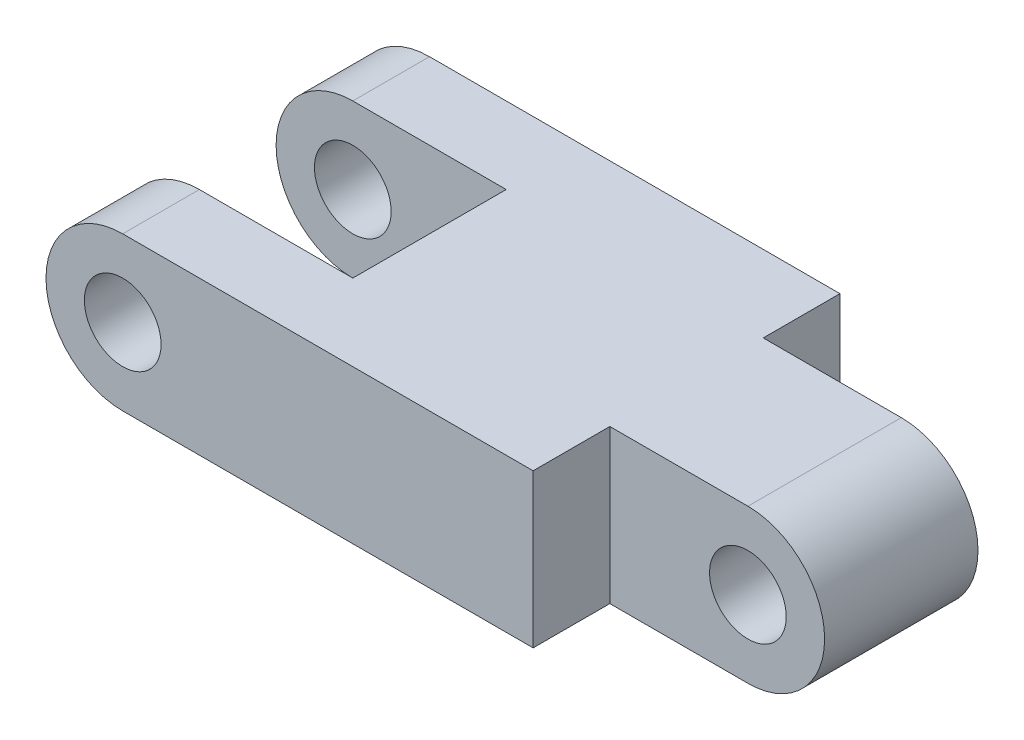
from build123d import *

# Parameters (mm, degrees)
BOSS_EXTRUDE1_DEPTH     = 40
CUT_EXTRUDE1_DEPTH      = 20
CUT_EXTRUDE1_DEPTH_BACK = 40
SKETCH2_W               = 20
SKETCH2_H               = 28.944782362
SKETCH3_R               = 5
CUT_EXTRUDE3_DEPTH      = 40
SKETCH5_R               = 5
BOSS_EXTRUDE2_DEPTH     = 20


with BuildPart() as part:
    # Sketch1 → Boss-Extrude1 (new body)
    with BuildSketch(Plane.XY):
        with BuildLine():
            Line((53.512258846, 10), (0, 10))
            ThreePointArc((0, 10), (-10, 0), (0, -10))
            Line((0, -10), (53.512258846, -10))
            Line((53.512258846, -10), (53.512258846, 10))
        make_face()
    extrude(amount=BOSS_EXTRUDE1_DEPTH)

    # Sketch2 → Cut-Extrude1 (cut, two sides: drawn at the far end of the back side and taken through both)
    with BuildSketch(Plane(origin=(0, 0, 0), x_dir=(0, 0, -1), z_dir=(1, 0, 0)).offset(-CUT_EXTRUDE1_DEPTH_BACK)):
        with Locations((-20, 0)):
            Rectangle(SKETCH2_W, SKETCH2_H)
    extrude(amount=CUT_EXTRUDE1_DEPTH + CUT_EXTRUDE1_DEPTH_BACK, mode=Mode.SUBTRACT)

    # Sketch3 → Cut-Extrude3 (cut)
    with BuildSketch(Plane.XY.offset(40)):
        Circle(SKETCH3_R)
    extrude(amount=-CUT_EXTRUDE3_DEPTH, mode=Mode.SUBTRACT)

    # Sketch5 → Boss-Extrude2 (add)
    with BuildSketch(Plane.XY.offset(30)):
        with BuildLine():
            Line((71.512258846, 10), (53.512258846, 10))
            Line((53.512258846, 10), (53.512258846, -10))
            Line((53.512258846, -10), (71.512258846, -10))
            ThreePointArc((71.512258846, -10), (81.512258846, 0), (71.512258846, 10))
        make_face()
        with Locations((71.512258846, 0)):
            Circle(SKETCH5_R, mode=Mode.SUBTRACT)
    extrude(amount=-BOSS_EXTRUDE2_DEPTH)


solid = part.part
